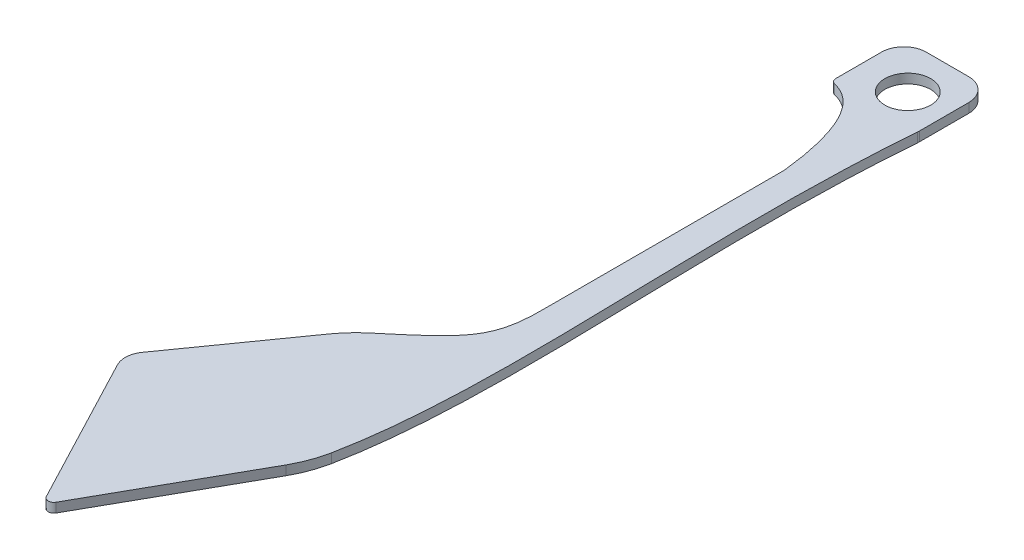
from build123d import *

# Parameters (mm, degrees)
BOSS_EXTRUDE1_DEPTH = 0.42
SKETCH2_R           = 2.05
CUT_EXTRUDE1_DEPTH  = 76.213334038
FILLET1_R           = 10
FILLET2_R           = 0.5
FILLET3_R           = 2
FILLET4_R           = 2
FILLET5_R           = 0.5
FILLET6_R           = 2


with BuildPart() as part:
    # Sketch1 → Boss-Extrude1 (new, symmetric)
    with BuildSketch(Plane(origin=(0, 0, 0), x_dir=(1, 0, 0), z_dir=(0, 1, 0))):
        with BuildLine():
            Line((2.5, 68), (2.5, 74.5))
            Line((2.5, 74.5), (10.3, 74.5))
            Line((10.3, 74.5), (10.3, 68))
            add(Edge.make_bspline(
                [(10.3, 68), (8.714398617, 49.11082539), (11.816891749, 28.482557039), (8.564530207, 15.25)],
                knots=[0, 0, 0, 0, 1, 1, 1, 1], degree=3))
            Line((8.564530207, 15.25), (0, 0))
            Line((0, 0), (-8, 15.25))
            Line((-8, 15.25), (0.382846681, 27.081224853))
            add(Edge.make_bspline(
                [(7.3, 38), (7.400709228, 32.674514217), (6.147076675, 31.910033807), (0.382846681, 27.081224853)],
                knots=[0, 0, 0, 0, 1, 1, 1, 1], degree=3))
            Line((7.3, 38), (7.3, 59))
            add(Edge.make_bspline(
                [(2.5, 68), (6.364741582, 67.576851124), (7.3, 59)],
                knots=[0, 0, 0, 1, 1, 1], degree=2))
        make_face()
    extrude(amount=BOSS_EXTRUDE1_DEPTH, both=True)

    # Sketch2 → Cut-Extrude1 (cut, through all)
    with BuildSketch(Plane(origin=(0, 0.42, 0), x_dir=(1, 0, 0), z_dir=(0, 1, 0))):
        with Locations(Location((6.75, 70.6, 0), (0, 0, 270))):
            Circle(SKETCH2_R)
    extrude(amount=-CUT_EXTRUDE1_DEPTH, mode=Mode.SUBTRACT)

    # Fillet1
    fillet1_edges = [part.edges().sort_by_distance(p)[0] for p in [
        (8.564530207, -0.21, -15.25),
        (0.382846681, -0.21, -27.081224853),
    ]]
    fillet(fillet1_edges, radius=FILLET1_R)

    # Fillet2
    fillet2_edges = [part.edges().sort_by_distance(p)[0] for p in [
        (2.5, -0.21, -68),
    ]]
    fillet(fillet2_edges, radius=FILLET2_R)

    # Fillet3
    fillet3_edges = [part.edges().sort_by_distance(p)[0] for p in [
        (2.5, 0, -74.5),
        (10.3, 0, -74.5),
    ]]
    fillet(fillet3_edges, radius=FILLET3_R)

    # Fillet4
    fillet4_edges = [part.edges().sort_by_distance(p)[0] for p in [
        (-8, 0, -15.25),
    ]]
    fillet(fillet4_edges, radius=FILLET4_R)

    # Fillet5
    fillet5_edges = [part.edges().sort_by_distance(p)[0] for p in [
        (0, 0, 0),
    ]]
    fillet(fillet5_edges, radius=FILLET5_R)

    # Fillet6
    # the kernel refuses this fillet: 2 mm, written as the material it adds along each edge
    with BuildSketch(Plane(origin=(7.3, 0, -59), x_dir=(0, 0, 1), z_dir=(0, -1, 0))) as fillet6_piece_1:
        with BuildLine():
            CenterArc((0.110157954, 2), FILLET6_R, 263.610060097, 6.389939903)
            ThreePointArc((-0.112430932, 0.012425048), (-0.056219986, 0.006171626), (0, 0))
            Line((0, 0), (0.110157954, 0))
        make_face()
    extrude(amount=0.42)
    with BuildSketch(Plane(origin=(7.3, 0, -59), x_dir=(0, 0, 1), z_dir=(0, 1, 0))) as fillet6_piece_2:
        with BuildLine():
            CenterArc((0.110157954, -2), FILLET6_R, 90, 6.389939903)
            ThreePointArc((-0.112430932, -0.012425048), (-0.056219986, -0.006171626), (0, 0))
            Line((0, 0), (0.110157954, 0))
        make_face()
    extrude(amount=0.42)
    # the kernel refuses this fillet: 2 mm, written as the material it takes off along each edge
    with BuildSketch(Plane(origin=(7.3, 0.046586814, -38), x_dir=(0, 0, -1), z_dir=(0, -1, 0))) as fillet6_2_piece_1:
        with BuildLine():
            CenterArc((0.018634726, 2), FILLET6_R, 268.947653116, 1.052346884)
            ThreePointArc((-0.018097045, 0.000337334), (-0.0090485, 0.000169892), (0, 0))
            Line((0, 0), (0.018634726, 0))
        make_face()
    extrude(amount=0.513173628, mode=Mode.SUBTRACT)
    with BuildSketch(Plane(origin=(10.3, 0, -68), x_dir=(-0.08328041944419425, 0, 0.9965261520588404), z_dir=(0, -1, 0))) as fillet6_2_piece_2:
        with BuildLine():
            CenterArc((0.083426948, 1.999999864), FILLET6_R, 265.222850471, 4.756036045)
            Line((-0.083133891, 0.00694756), (0, 0))
            ThreePointArc((0, 0), (0.041344974, 7.623e-06), (0.082689948, 0))
        make_face()
    extrude(amount=0.628559231, mode=Mode.SUBTRACT)
    with BuildSketch(Plane(origin=(10.3, 0, -68), x_dir=(-0.08328041944419425, 0, 0.9965261520588404), z_dir=(0, 1, 0))) as fillet6_2_piece_3:
        with BuildLine():
            CenterArc((0.083426948, -1.999999864), FILLET6_R, 90.021113485, 4.756036045)
            Line((-0.083133891, -0.00694756), (0, 0))
            ThreePointArc((0, 0), (0.041344974, -7.623e-06), (0.082689948, 0))
        make_face()
    extrude(amount=0.628559231, mode=Mode.SUBTRACT)


solid = part.part
